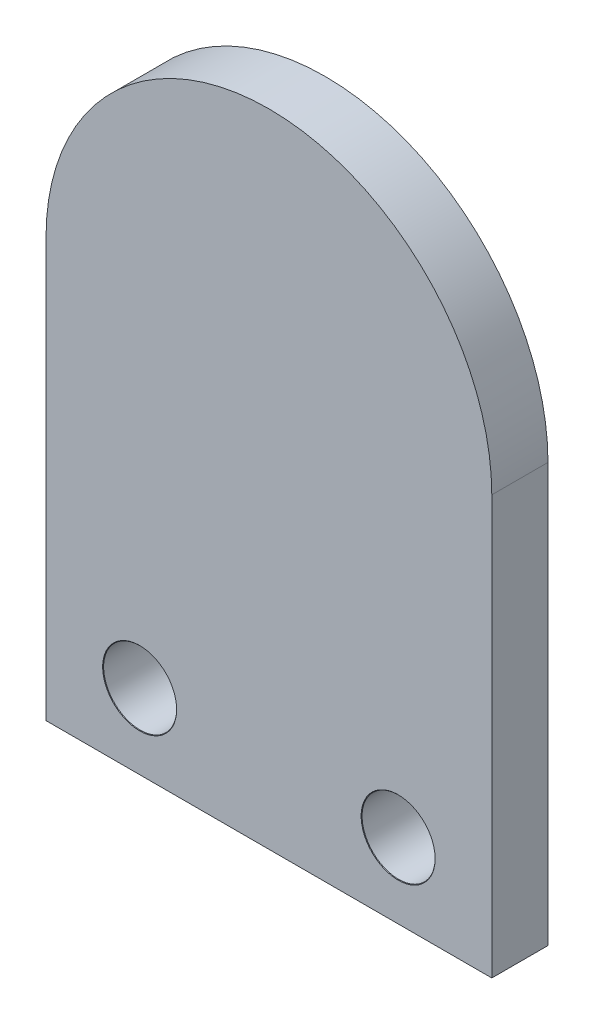
from build123d import *

# Parameters (mm, degrees)
BOSS_EXTRUDE1_DEPTH              = 3
SKETCH2_R                        = 1.95
BOSS_EXTRUDE2_DEPTH              = 3
M3_5_CLEARANCE_HOLE1_D           = 3.9
M3_5_CLEARANCE_HOLE1_CSINK_D     = 3.95
M3_5_CLEARANCE_HOLE1_CSINK_ANGLE = 90


with BuildPart() as part:
    # Sketch1 → Boss-Extrude1 (new body)
    with BuildSketch(Plane.XY):
        with BuildLine():
            Line((-11.9, 0), (-11.9, -22.34))
            Line((-11.9, -22.34), (11.9, -22.34))
            Line((11.9, -22.34), (11.9, 0))
            ThreePointArc((11.9, 0), (0, 11.9), (-11.9, 0))
        make_face()
    extrude(amount=BOSS_EXTRUDE1_DEPTH)

    # Sketch2 → Boss-Extrude2 (add)
    with BuildSketch(Plane(origin=(0, 0, 0), x_dir=(-1, 0, 0), z_dir=(0, 0, -1))):
        with Locations((0, 6)):
            Circle(SKETCH2_R)
        with Locations((6, 0)):
            Circle(SKETCH2_R)
        with Locations((0, -6)):
            Circle(SKETCH2_R)
        with Locations((-6, 0)):
            Circle(SKETCH2_R)
    extrude(amount=BOSS_EXTRUDE2_DEPTH)

    # M3.5 Clearance Hole1 (through all)
    with Locations(Plane.XY.offset(3)):
        with Locations((6.9, -18.34), (-6.9, -18.34)):
            CounterSinkHole(M3_5_CLEARANCE_HOLE1_D / 2, M3_5_CLEARANCE_HOLE1_CSINK_D / 2, counter_sink_angle=M3_5_CLEARANCE_HOLE1_CSINK_ANGLE)


solid = part.part
